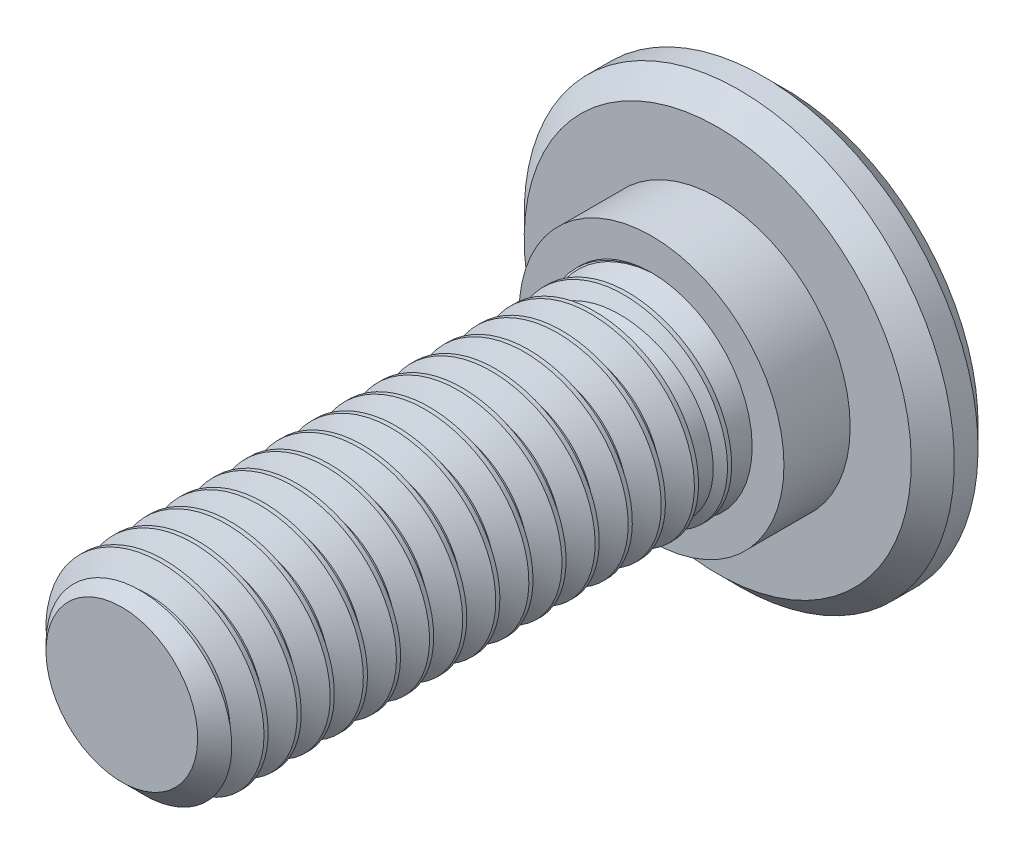
from build123d import *

# Parameters (mm, degrees)
CHAMFER2_SIZE       = 0.5953125
CUT_EXTRUDE1_DEPTH  = 1.7859375
CHAMFER1_SIZE       = 0.51562
SKETCH11_R          = 3.175
BOSS_EXTRUDE1_DEPTH = 1.5875
CUT_SWEEP1_PITCH    = 0.79375
CUT_SWEEP1_TO       = 12.7
SKETCH12_R          = 2.413
BOSS_EXTRUDE2_DEPTH = 1.7859375
BOSS_EXTRUDE2_TAPER = 17


with BuildPart() as part:
    # Sketch13 → Revolve1 (revolve)
    with BuildSketch(Plane(origin=(0, 0, 0), x_dir=(0, 0, -1), z_dir=(1, 0, 0)), mode=Mode.PRIVATE) as revolve1_sk:
        Polygon((1.6002, 5.1562), (0, 5.1562), (0, 2.413), (-14.2875, 2.413), (-14.2875, 0), (1.6002, 0), align=None)
    revolve(revolve1_sk.sketch.rotate(Axis((0, 0, 14.2875), (0, 0, -1)), 180), axis=Axis((0, 0, 14.2875), (0, 0, -1)))

    # Chamfer2
    chamfer2_edges = [part.edges().sort_by_distance(p)[0] for p in [
        (0, 2.413, 14.2875),
    ]]
    chamfer(chamfer2_edges, length=CHAMFER2_SIZE)

    # Sketch7 → Cut-Extrude1 (cut)
    with BuildSketch(Plane(origin=(0, 0, -1.6002), x_dir=(-1, 0, 0), z_dir=(0, 0, -1))):
        Polygon((0, 1.374815329), (-1.190625, 0.687407664), (-1.190625, -0.687407664), (0, -1.374815329), (1.190625, -0.687407664), (1.190625, 0.687407664), align=None)
    extrude(amount=-CUT_EXTRUDE1_DEPTH, mode=Mode.SUBTRACT)

    # Chamfer1
    chamfer1_edges = [part.edges().sort_by_distance(p)[0] for p in [
        (0, 5.1562, 0),
        (0, 5.1562, -1.6002),
    ]]
    chamfer(chamfer1_edges, length=CHAMFER1_SIZE)

    # Cut-Extrude2 cone 1 section (through the dimple's axis) → Cut-Extrude2 (revolve, cut)
    with BuildSketch(Plane(origin=(0, 0, -1.6002), x_dir=(0, 1, 0), z_dir=(1, 0, 0))):
        Polygon((0, 0), (1.374815329, 0), (0, 1.374815329), align=None)
    revolve(axis=Axis((0, 0, -1.6002), (0, 0, 1)), mode=Mode.SUBTRACT)

    # Sketch11 → Boss-Extrude1 (add)
    with BuildSketch(Plane.XY):
        with Locations(Location((0, 0, 0), (0, 0, 90))):
            Circle(SKETCH11_R)
    extrude(amount=BOSS_EXTRUDE1_DEPTH)


with BuildPart() as body_2:
    # Split1: read off the stored shape, not the designer's step
    # Split1: the piece on the far side of the plane
    add(part.part)
    split(bisect_by=Plane.XY.offset(1.5875), keep=Keep.BOTTOM)


with BuildPart() as part_1:
    add(part.part)

    # Split1
    split(bisect_by=Plane.XY.offset(1.5875), keep=Keep.TOP)

    # Cut-Sweep1: arcs per turn and ends read off the stored shape
    # Cut-Sweep1: the profile of Sketch3 screwed along a right-hand helix through 20 turns, 6 arcs to a turn; built about Z, then put on its axis
    cut_sweep1_z = Axis((0, 0, 0), (0, 0, 1))
    cut_sweep1_corners = [(2.455962979, 0, -0.719335938), (2.455962979, 0, 0.024804687), (1.897444252, 0, -0.29765625), (1.897444252, 0, -0.396875)]
    with BuildLine(mode=Mode.PRIVATE) as cut_sweep1_profile:
        Line(cut_sweep1_corners[0], cut_sweep1_corners[1])
        Line(cut_sweep1_corners[1], cut_sweep1_corners[2])
        Line(cut_sweep1_corners[2], cut_sweep1_corners[3])
        Line(cut_sweep1_corners[3], cut_sweep1_corners[0])
    cut_sweep1_cap = Face(cut_sweep1_profile.wire())
    cut_sweep1_turn_angles = [0, 30, 60, 90, 120, 150, 180, 210, 240, 270, 300, 330, 360]
    cut_sweep1_turn_weights = [1, 0.8660254037844387, 1, 0.8660254037844387, 1, 0.8660254037844387, 1, 0.8660254037844387, 1, 0.8660254037844387, 1, 0.8660254037844387, 1]
    cut_sweep1_turn_rails = [Edge.make_bspline([Vector(p[0], p[1], 0).rotate(cut_sweep1_z, cut_sweep1_turn_angles[k]) / cut_sweep1_turn_weights[k] + Vector(0, 0, p[2] + CUT_SWEEP1_PITCH * cut_sweep1_turn_angles[k] / 360) for k in range(13)], [0, 0, 0, 1, 1, 2, 2, 3, 3, 4, 4, 5, 5, 6, 6, 6], 2, cut_sweep1_turn_weights) for p in cut_sweep1_corners]
    cut_sweep1_turn_sides = [Face.make_surface_from_curves(cut_sweep1_turn_rails[p[0]], cut_sweep1_turn_rails[p[1]]) for p in [(0, 1), (1, 2), (2, 3), (3, 0)]]
    cut_sweep1 = Plane(origin=(0, 0, 14.2875), x_dir=(0, 1, 0), z_dir=(0, 0, -1)) * split(Solid(Shell([*[p.moved(Location((0, 0, CUT_SWEEP1_PITCH * i))) for i in range(20) for p in cut_sweep1_turn_sides], cut_sweep1_cap, cut_sweep1_cap.rotate(cut_sweep1_z, 7200).moved(Location((0, 0, CUT_SWEEP1_PITCH * 7200 / 360)))])), bisect_by=Plane.XY.offset(CUT_SWEEP1_TO), keep=Keep.BOTTOM, mode=Mode.PRIVATE)
    add(cut_sweep1, mode=Mode.SUBTRACT)

    add(body_2.part)  # Boss-Extrude2 merges body 2
    # Sketch12 → Boss-Extrude2 (add)
    with BuildSketch(Plane.XY.offset(1.5875)):
        Circle(SKETCH12_R)
    extrude(amount=BOSS_EXTRUDE2_DEPTH, taper=BOSS_EXTRUDE2_TAPER)


solid = part_1.part
